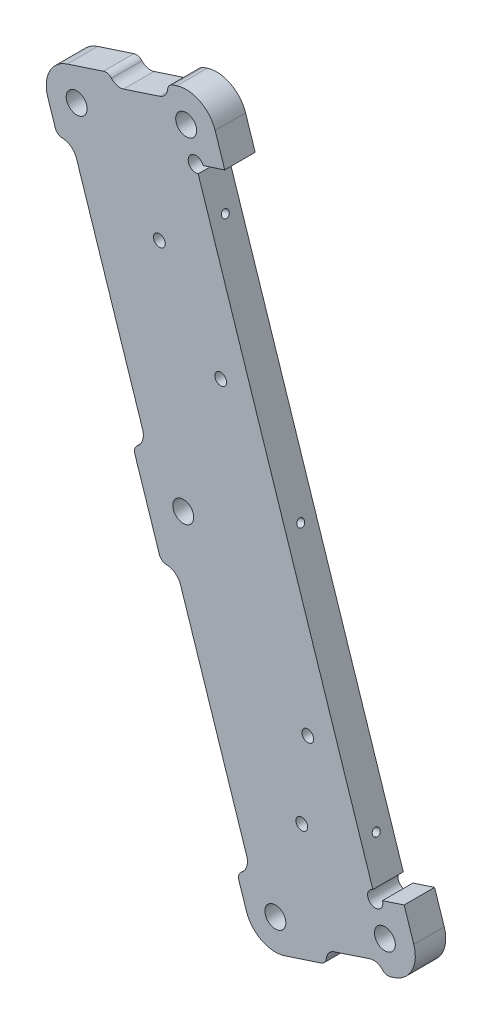
from build123d import *

# Parameters (mm, degrees)
BOSS_EXTRUDE1_DEPTH                               = 12.7
FILLET1_R                                         = 12.7
F_1_4_0_25_DIAMETER_HOLE1_D                       = 6.35
HOLE1_D                                           = 3.175
HOLE1_DEPTH                                       = 38.1
HOLE1_CSINK_D                                     = 10.16
HOLE1_CSINK_ANGLE                                 = 82
HOLE1_TIP                                         = 0.953866233
F_5_16_CLEARANCE_HOLE1_D                          = 8.72998
CUT_EXTRUDE1_DEPTH                                = 998.276795789
FILLET2_R                                         = 3.175
CSK_FOR_8_FLAT_HEAD_MACHINE_SCREW_100_D           = 4.9149
CSK_FOR_8_FLAT_HEAD_MACHINE_SCREW_100_DEPTH       = 22.225
CSK_FOR_8_FLAT_HEAD_MACHINE_SCREW_100_CSINK_D     = 16.0004506
CSK_FOR_8_FLAT_HEAD_MACHINE_SCREW_100_CSINK_ANGLE = 100
CSK_FOR_8_FLAT_HEAD_MACHINE_SCREW_100_TIP         = 1.476584928


with BuildPart() as part:
    # Sketch1 → Boss-Extrude1 (new body)
    with BuildSketch(Plane.XY):
        Polygon((-562.304471255, 806.232107663), (-471.539452891, 529.538747716), (-401.754552913, 552.430615195), (-409.733909301, 576.755349206), (-421.801231915, 572.796848868), (-496.607537503, 800.840740793), (-484.540214889, 804.799241131), (-492.519571277, 829.123975142), align=None)
    extrude(amount=BOSS_EXTRUDE1_DEPTH)

    # Fillet1
    fillet1_edges = [part.edges().sort_by_distance(p)[0] for p in [
        (-471.539452891, 529.538747716, 6.35),
        (-562.304471255, 806.232107663, 6.35),
        (-401.754552913, 552.430615195, 6.35),
        (-492.519571277, 829.123975142, 6.35),
    ]]
    fillet(fillet1_edges, radius=FILLET1_R)

    # 1/4 (0.25) Diameter Hole1 (through all)
    with Locations(Plane(origin=(0, 0, 0), x_dir=(-1, 0, 0), z_dir=(0, 0, -1))):
        with Locations((496.607537503, 800.840740793), (421.801231915, 572.796848868)):
            Hole(F_1_4_0_25_DIAMETER_HOLE1_D / 2)

    # Hole1
    with Locations(Plane(origin=(-72.821982256, -450.306560551, -91.074999997), x_dir=(0, 0, -1), z_dir=(0.9501828830204595, 0.3116929399504066, 0))):
        with Locations((-97.424999997, 1099.959715498), (-97.424999997, 1301.859715498), (-97.424999997, 1200.909715498)):
            CounterSinkHole(HOLE1_D / 2, HOLE1_CSINK_D / 2, depth=HOLE1_DEPTH, counter_sink_angle=HOLE1_CSINK_ANGLE)
            with Locations((0, 0, -(HOLE1_DEPTH + HOLE1_TIP / 2))):  # 118° drill point
                Cone(0, HOLE1_D / 2, HOLE1_TIP, mode=Mode.SUBTRACT)

    # 5/16 Clearance Hole1 (through all)
    with Locations(Plane.XY.offset(12.7)):
        with Locations((-546.278648304, 798.123285386), (-500.628393554, 813.09815219), (-463.430630614, 545.564570668), (-417.780375865, 560.539437472), (-501.837808805, 672.833553111)):
            Hole(F_5_16_CLEARANCE_HOLE1_D / 2)

    # Sketch9 → Cut-Extrude1 (cut, through all)
    with BuildSketch(Plane.XY.offset(12.7)):
        with BuildLine():
            Line((-529.695301492, 821.941239305), (-514.611148225, 826.889364727))
            ThreePointArc((-514.611148225, 826.889364727), (-508.601464618, 823.848556373), (-511.642272971, 817.838872766))
            Line((-511.642272971, 817.838872766), (-526.726426239, 812.890747344))
            ThreePointArc((-526.726426239, 812.890747344), (-532.736109846, 815.931555698), (-529.695301492, 821.941239305))
        make_face()
        with BuildLine():
            Line((-546.374559105, 778.043051296), (-518.805301441, 693.999323087))
            ThreePointArc((-518.805301441, 693.999323087), (-522.859712579, 685.986411611), (-530.872624055, 690.04082275))
            Line((-530.872624055, 690.04082275), (-558.441881719, 774.084550959))
            ThreePointArc((-558.441881719, 774.084550959), (-554.387470581, 782.097462435), (-546.374559105, 778.043051296))
        make_face()
        with BuildLine():
            Line((-435.961407875, 536.197387397), (-420.877254607, 541.145512818))
            ThreePointArc((-420.877254607, 541.145512818), (-417.836446253, 547.155196425), (-423.84612986, 550.196004779))
            Line((-423.84612986, 550.196004779), (-438.930283128, 545.247879358))
            ThreePointArc((-438.930283128, 545.247879358), (-441.971091482, 539.238195751), (-435.961407875, 536.197387397))
        make_face()
        with BuildLine():
            Line((-475.402042427, 561.686304421), (-502.971300091, 645.73003263))
            ThreePointArc((-502.971300091, 645.73003263), (-510.984211567, 649.784443768), (-515.038622706, 641.771532292))
            Line((-515.038622706, 641.771532292), (-487.469365042, 557.727804083))
            ThreePointArc((-487.469365042, 557.727804083), (-479.456453566, 553.673392945), (-475.402042427, 561.686304421))
        make_face()
    extrude(amount=-CUT_EXTRUDE1_DEPTH, mode=Mode.SUBTRACT)

    # Fillet2
    fillet2_edges = [part.edges().sort_by_distance(p)[0] for p in [
        (-508.601464618, 823.848556373, 6.35),
        (-532.736109846, 815.931555698, 6.35),
        (-417.836446253, 547.155196425, 6.35),
        (-441.971091482, 539.238195751, 6.35),
        (-479.456453566, 553.673392945, 6.35),
        (-510.984211567, 649.784443768, 6.35),
        (-522.859712579, 685.986411611, 6.35),
        (-554.387470581, 782.097462435, 6.35),
    ]]
    fillet(fillet2_edges, radius=FILLET2_R)

    # CSK for #8 Flat Head Machine Screw (100)2
    with Locations(Plane(origin=(322.256840723, -320.707004458, 0), x_dir=(-0.9977564584489056, 0.06694811142592035, 0), z_dir=(0, 0, -1))):
        with Locations((876.906978493, 992.672305446), (833.265235439, 884.655200952), (904.92137181, 1028.108129087), (833.558815764, 851.479604792)):
            CounterSinkHole(CSK_FOR_8_FLAT_HEAD_MACHINE_SCREW_100_D / 2, CSK_FOR_8_FLAT_HEAD_MACHINE_SCREW_100_CSINK_D / 2, depth=CSK_FOR_8_FLAT_HEAD_MACHINE_SCREW_100_DEPTH, counter_sink_angle=CSK_FOR_8_FLAT_HEAD_MACHINE_SCREW_100_CSINK_ANGLE)
            with Locations((0, 0, -(CSK_FOR_8_FLAT_HEAD_MACHINE_SCREW_100_DEPTH + CSK_FOR_8_FLAT_HEAD_MACHINE_SCREW_100_TIP / 2))):  # 118° drill point
                Cone(0, CSK_FOR_8_FLAT_HEAD_MACHINE_SCREW_100_D / 2, CSK_FOR_8_FLAT_HEAD_MACHINE_SCREW_100_TIP, mode=Mode.SUBTRACT)


solid = part.part
